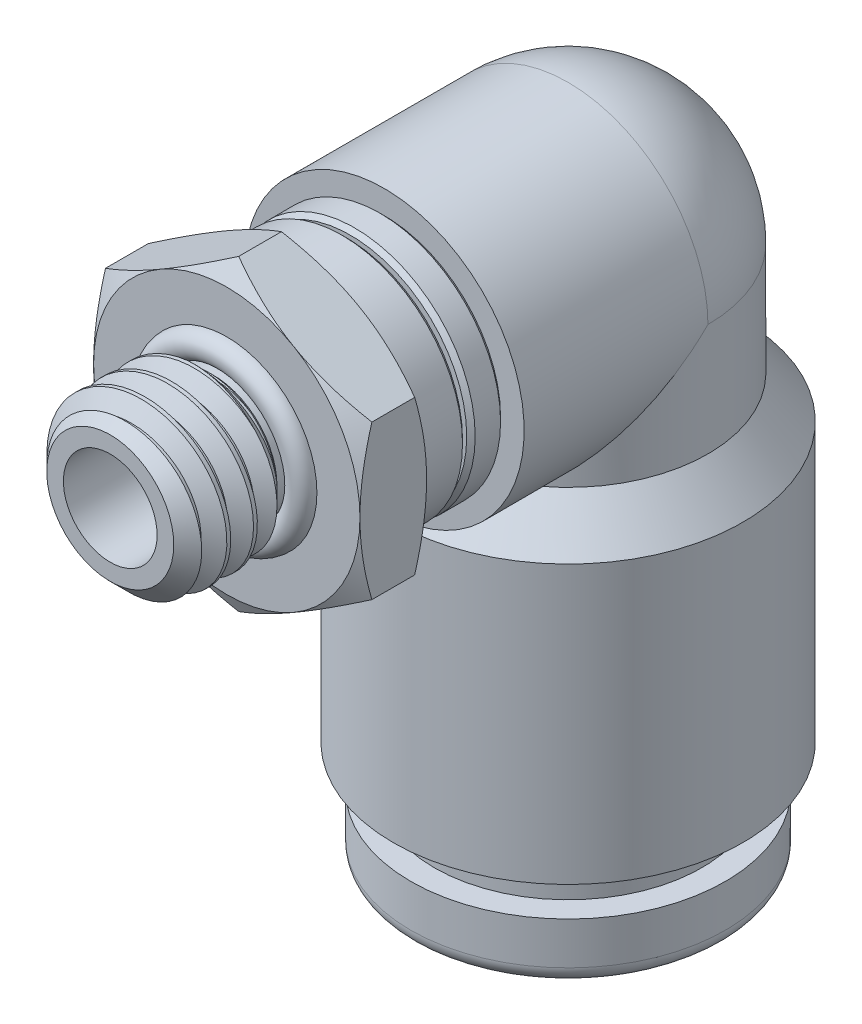
from build123d import *

# Parameters (mm, degrees)
SKETCH1_R          = 2.5
EXTRUDE1_DEPTH     = 3.5
CUT_SWEEP1_PITCH   = 0.8
EXTRUDE2_DEPTH     = 2
SKETCH6_OUTSIDE_W  = 44.622
SKETCH6_OUTSIDE_H  = 45.86
SKETCH6_OUTSIDE_R  = 4
CUT_EXTRUDE1_DEPTH = 9.22090837
CUT_EXTRUDE1_DRAFT = -60
SKETCH7_OUTSIDE_W  = 40.536
SKETCH7_OUTSIDE_H  = 41.774
SKETCH7_OUTSIDE_R  = 4
CUT_EXTRUDE2_DEPTH = 8.041543441
CUT_EXTRUDE2_DRAFT = -60
CHAMFER1_SIZE      = 0.127
SKETCH23_R         = 4.2
EXTRUDE3_DEPTH     = 5.5195
REVOLVE3_ANGLE     = 90
SKETCH18_R         = 1.407179677
CUT_EXTRUDE5_DEPTH = 3.5
SKETCH32_R         = 3
EXTRUDE5_DEPTH     = 4.618802
SKETCH33_R         = 2.365
CUT_EXTRUDE6_DEPTH = 4.618802
CUT_REVOLVE2_ANGLE = 90
SKETCH35_R         = 2.365
CUT_EXTRUDE7_DEPTH = 3
SKETCH36_R         = 1.407179677
CUT_EXTRUDE8_DEPTH = 10.75
SKETCH38_W         = 0.8
SKETCH38_H         = 0.8
SKETCH39_R         = 0.4


# Read off the part's stored shape, not the designer's step: Extrude4
with BuildPart() as part:
    # Sketch1 → Extrude1 (new body)
    with BuildSketch(Plane.XY):
        Circle(SKETCH1_R)
    extrude(amount=-EXTRUDE1_DEPTH)

    # Cut-Sweep1: the profile of Sketch3 screwed along a right-hand helix of 5.375 turns, 6 arcs to a turn; built about Z, then put on its axis
    cut_sweep1_z = Axis((0, 0, 0), (0, 0, 1))
    cut_sweep1_corners = [(2.55, 0, -0.71339746), (2.007179677, 0, -0.4), (2.007179677, 0, -0.284529946), (2.55, 0, 0.028867513)]
    with BuildLine(mode=Mode.PRIVATE) as cut_sweep1_profile:
        Line(cut_sweep1_corners[0], cut_sweep1_corners[1])
        Line(cut_sweep1_corners[1], cut_sweep1_corners[2])
        Line(cut_sweep1_corners[2], cut_sweep1_corners[3])
        Line(cut_sweep1_corners[3], cut_sweep1_corners[0])
    cut_sweep1_cap = Face(cut_sweep1_profile.wire())
    cut_sweep1_turn_angles = [0, 30, 60, 90, 120, 150, 180, 210, 240, 270, 300, 330, 360]
    cut_sweep1_turn_weights = [1, 0.8660254037844387, 1, 0.8660254037844387, 1, 0.8660254037844387, 1, 0.8660254037844387, 1, 0.8660254037844387, 1, 0.8660254037844387, 1]
    cut_sweep1_turn_rails = [Edge.make_bspline([Vector(p[0], p[1], 0).rotate(cut_sweep1_z, cut_sweep1_turn_angles[k]) / cut_sweep1_turn_weights[k] + Vector(0, 0, p[2] + CUT_SWEEP1_PITCH * cut_sweep1_turn_angles[k] / 360) for k in range(13)], [0, 0, 0, 1, 1, 2, 2, 3, 3, 4, 4, 5, 5, 6, 6, 6], 2, cut_sweep1_turn_weights) for p in cut_sweep1_corners]
    cut_sweep1_turn_sides = [Face.make_surface_from_curves(cut_sweep1_turn_rails[p[0]], cut_sweep1_turn_rails[p[1]]) for p in [(0, 1), (1, 2), (2, 3), (3, 0)]]
    cut_sweep1_last_angles = [1800, 1830, 1860, 1890, 1920, 1927.5, 1935]
    cut_sweep1_last_weights = [1, 0.8660254037844387, 1, 0.8660254037844387, 1, 0.9914448613738065, 1]
    cut_sweep1_last_rails = [Edge.make_bspline([Vector(p[0], p[1], 0).rotate(cut_sweep1_z, cut_sweep1_last_angles[k]) / cut_sweep1_last_weights[k] + Vector(0, 0, p[2] + CUT_SWEEP1_PITCH * cut_sweep1_last_angles[k] / 360) for k in range(7)], [0, 0, 0, 1, 1, 2, 2, 3, 3, 3], 2, cut_sweep1_last_weights) for p in cut_sweep1_corners]
    cut_sweep1_last_sides = [Face.make_surface_from_curves(cut_sweep1_last_rails[p[0]], cut_sweep1_last_rails[p[1]]) for p in [(0, 1), (1, 2), (2, 3), (3, 0)]]
    cut_sweep1 = Plane(origin=(0, 0, 0), x_dir=(0, 1, 0), z_dir=(0, 0, -1)) * Solid(Shell([*[p.moved(Location((0, 0, CUT_SWEEP1_PITCH * i))) for i in range(5) for p in cut_sweep1_turn_sides], *cut_sweep1_last_sides, cut_sweep1_cap, cut_sweep1_cap.rotate(cut_sweep1_z, 1935).moved(Location((0, 0, CUT_SWEEP1_PITCH * 1935 / 360)))]))
    add(cut_sweep1, mode=Mode.SUBTRACT)

    # Sketch4 → Cut-Revolve1 (revolve, cut)
    with BuildSketch(Plane(origin=(0, 0, 0), x_dir=(0, 0, -1), z_dir=(1, 0, 0)), mode=Mode.PRIVATE) as cut_revolve1_sk:
        Polygon((3.5, 1.907179677), (3.1, 1.907179677), (2.407179677, 2.6), (3.5, 2.6), align=None)
        Polygon((0.692820323, 2.6), (0, 1.907179677), (0, 2.6), align=None)
    revolve(cut_revolve1_sk.sketch.rotate(Axis((0, 0, 0), (0, 0, -1)), 90), axis=Axis((0, 0, 0), (0, 0, -1)), mode=Mode.SUBTRACT)

    # Sketch5 → Extrude2 (add)
    with BuildSketch(Plane(origin=(0, 0, -3.5), x_dir=(-1, 0, 0), z_dir=(0, 0, -1))):
        Polygon((0, 4.618802154), (-4, 2.309401077), (-4, -2.309401077), (0, -4.618802154), (4, -2.309401077), (4, 2.309401077), align=None)
    extrude(amount=EXTRUDE2_DEPTH)


with BuildPart() as cut_extrude1_tool:
    # Sketch6 outside → Cut-Extrude1 (with draft: the straight prism first)
    with BuildSketch(Plane(origin=(0, 0, -5.5), x_dir=(-1, 0, 0), z_dir=(0, 0, -1))):
        Rectangle(SKETCH6_OUTSIDE_W, SKETCH6_OUTSIDE_H)
        Circle(SKETCH6_OUTSIDE_R, mode=Mode.SUBTRACT)
    extrude(amount=-CUT_EXTRUDE1_DEPTH)
    # Cut-Extrude1: the draft: its side faces are tilted about the plane it starts from
    cut_extrude1_sides = [cut_extrude1_tool.faces().sort_by_distance(p)[0] for p in [
        (0, -22.93, -0.889545815),
        (-22.311, 0, -0.889545815),
        (0, 22.93, -0.889545815),
        (22.311, 0, -0.889545815),
        (4, 0, -0.889545815),
    ]]
    draft(cut_extrude1_sides, Plane(origin=(0, 0, -5.5), x_dir=(-1, 0, 0), z_dir=(0, 0, -1)), CUT_EXTRUDE1_DRAFT)


with BuildPart() as part_1:
    add(part.part)

    # Cut-Extrude1: cut by cut_extrude1_tool
    add(cut_extrude1_tool.part, mode=Mode.SUBTRACT)


with BuildPart() as cut_extrude2_tool:
    # Sketch7 outside → Cut-Extrude2 (with draft: the straight prism first)
    with BuildSketch(Plane.XY.offset(-3.5)):
        Rectangle(SKETCH7_OUTSIDE_W, SKETCH7_OUTSIDE_H)
        Circle(SKETCH7_OUTSIDE_R, mode=Mode.SUBTRACT)
    extrude(amount=-CUT_EXTRUDE2_DEPTH)
    # Cut-Extrude2: the draft: its side faces are tilted about the plane it starts from
    cut_extrude2_sides = [cut_extrude2_tool.faces().sort_by_distance(p)[0] for p in [
        (0, -20.887, -7.520771721),
        (20.268, 0, -7.520771721),
        (0, 20.887, -7.520771721),
        (-20.268, 0, -7.520771721),
        (-4, 0, -7.520771721),
    ]]
    draft(cut_extrude2_sides, Plane.XY.offset(-3.5), CUT_EXTRUDE2_DRAFT)


with BuildPart() as part_2:
    add(part_1.part)

    # Cut-Extrude2: cut by cut_extrude2_tool
    add(cut_extrude2_tool.part, mode=Mode.SUBTRACT)

    # Sketch11 → Revolve2 (revolve)
    with BuildSketch(Plane(origin=(0, 0, 0), x_dir=(0, 0, -1), z_dir=(1, 0, 0)), mode=Mode.PRIVATE) as revolve2_sk:
        Polygon((5.5, -3.619), (7.0875, -3.619), (7.0875, -2.476), (7.2145, -2.476), (7.2145, -3.619), (8.2305, -3.619), (8.2305, 0), (5.5, 0), align=None)
    revolve(revolve2_sk.sketch.rotate(Axis((0, 0, 0), (0, 0, -1)), 270), axis=Axis((0, 0, 0), (0, 0, -1)))

    # Chamfer1
    chamfer1_edges = [part_2.edges().sort_by_distance(p)[0] for p in [
        (-3.619, 0, -8.2305),
        (-3.619, 0, -7.2145),
        (-3.619, 0, -7.0875),
    ]]
    chamfer(chamfer1_edges, length=CHAMFER1_SIZE)

    # Sketch23 → Extrude3 (add)
    with BuildSketch(Plane(origin=(0, 0, -8.2305), x_dir=(-1, 0, 0), z_dir=(0, 0, -1))):
        Circle(SKETCH23_R)
    extrude(amount=EXTRUDE3_DEPTH)



with BuildPart() as body_2:
    # Sketch10 → Revolve1 (revolve)
    with BuildSketch(Plane(origin=(0, 0, 0), x_dir=(0, 0, -1), z_dir=(1, 0, 0))):
        with BuildLine():
            Line((9.533, -16), (10.369, -16))
            Line((10.369, -16), (10.75, -15.619))
            Line((10.75, -15.619), (10.75, -1.93735657))
            Line((10.75, -1.93735657), (8.5, -4.618802154))
            Line((8.5, -4.618802154), (8.5, -12.952))
            Line((8.5, -12.952), (9.73375, -12.952))
            Line((9.73375, -12.952), (9.73375, -14.222))
            Line((9.73375, -14.222), (9.025, -14.222))
            Line((9.025, -14.222), (9.025, -15.492))
            ThreePointArc((9.025, -15.492), (9.173789755, -15.851210245), (9.533, -16))
        make_face()
    revolve(axis=Axis((0, 0, -13.75), (0, -1, 0)))


with BuildPart() as part_3:
    add(part_2.part)

    add(body_2.part)  # Extrude4 merges body 2
    # Extrude4 outline → Extrude4 (revolve)
    with BuildSketch(Plane.XY.offset(-13.75)):
        Polygon((3, -3.367460881), (4.2, -3.367460881), (4.2, 0), (1.374364817, 0), (3, -1.93735657), align=None)
    revolve(axis=Axis((0, 0, -13.75), (0, 1, 0)))

    # Sketch31 → Revolve3 (revolve)
    with BuildSketch(Plane(origin=(0, 0, -13.75), x_dir=(-1, 0, 0), z_dir=(0, 0, -1))):
        with BuildLine():
            Line((-4.2, 0), (4.2, 0))
            ThreePointArc((4.2, 0), (0, 4.2), (-4.2, 0))
        make_face()
    revolve(axis=Axis((4.2, 0, -13.75), (-1, 0, 0)), revolution_arc=REVOLVE3_ANGLE)

    # Sketch18 → Cut-Extrude5 (cut)
    with BuildSketch(Plane.XY):
        Circle(SKETCH18_R)
    extrude(amount=-CUT_EXTRUDE5_DEPTH, mode=Mode.SUBTRACT)

    # Sketch32 → Extrude5 (add)
    with BuildSketch(Plane(origin=(0, 0, 0), x_dir=(1, 0, 0), z_dir=(0, 1, 0))):
        with Locations(Location((0, 13.75, 0), (0, 0, 270))):
            Circle(SKETCH32_R)
    extrude(amount=-EXTRUDE5_DEPTH)

    # Sketch33 → Cut-Extrude6 (cut)
    with BuildSketch(Plane.XZ.offset(4.618802154)):
        with Locations(Location((0, -13.75, 0), (0, 0, 270))):
            Circle(SKETCH33_R)
    extrude(amount=-CUT_EXTRUDE6_DEPTH, mode=Mode.SUBTRACT)

    # Sketch34 → Cut-Revolve2 (revolve, cut)
    with BuildSketch(Plane.XZ):
        with BuildLine():
            Line((-2.365, -13.75), (2.365, -13.75))
            ThreePointArc((2.365, -13.75), (0, -16.115), (-2.365, -13.75))
        make_face()
    revolve(axis=Axis((2.365, 0, -13.75), (1, 0, 0)), revolution_arc=CUT_REVOLVE2_ANGLE, mode=Mode.SUBTRACT)

    # Sketch35 → Cut-Extrude7 (cut)
    with BuildSketch(Plane(origin=(0, 0, -13.75), x_dir=(-1, 0, 0), z_dir=(0, 0, -1))):
        with Locations(Location((0, 0, 0), (0, 0, 90))):
            Circle(SKETCH35_R)
    extrude(amount=-CUT_EXTRUDE7_DEPTH, mode=Mode.SUBTRACT)

    # Sketch36 → Cut-Extrude8 (cut)
    with BuildSketch(Plane.XY):
        Circle(SKETCH36_R)
    extrude(amount=-CUT_EXTRUDE8_DEPTH, mode=Mode.SUBTRACT)

    # Sketch38 → Cut-Revolve3 (revolve, cut)
    with BuildSketch(Plane(origin=(0, 0, 0), x_dir=(0, 0, -1), z_dir=(1, 0, 0)), mode=Mode.PRIVATE) as cut_revolve3_sk:
        with Locations((3.5, 2.307179677)):
            Rectangle(SKETCH38_W, SKETCH38_H)
    revolve(cut_revolve3_sk.sketch.rotate(Axis((0, 0, 0), (0, 0, -1)), 266.913268162), axis=Axis((0, 0, 0), (0, 0, -1)), mode=Mode.SUBTRACT)


with BuildPart() as body_2_2:
    # Sketch39 → Revolve5 (revolve)
    with BuildSketch(Plane(origin=(0, 0, 0), x_dir=(0, 0, -1), z_dir=(1, 0, 0)), mode=Mode.PRIVATE) as revolve5_sk:
        with Locations((3.5, 2.307179677)):
            Circle(SKETCH39_R)
    revolve(revolve5_sk.sketch.rotate(Axis((0, 0, 0), (0, 0, -1)), 266.913268162), axis=Axis((0, 0, 0), (0, 0, -1)))


solid = Compound([part_3.part, body_2_2.part])
